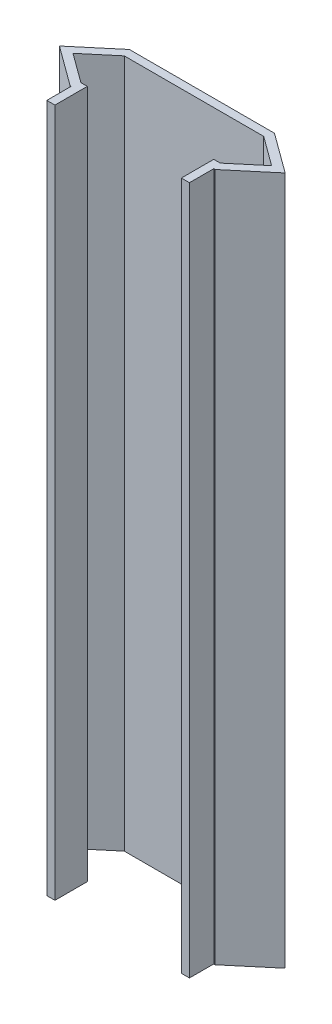
from build123d import *

# Parameters (mm, degrees)
BOSS_EXTRUDE2_DEPTH = 85


with BuildPart() as part:
    # Sketch1 → Boss-Extrude2 (new body)
    with BuildSketch(Plane(origin=(0, 0, 0), x_dir=(1, 0, 0), z_dir=(0, 1, 0))):
        Polygon((-9.289540275, -0.938702324), (-5.852697561, 1.95337278), (11.354665719, 1.95337278), (14.971998662, -0.690062833), (11.535155949, -3.582137937), (10.725726632, -3.582137937), (10.725726632, -6.582137937), (10.725726632, -7.582137937), (11.725726632, -7.582137937), (11.725726632, -4.582137937), (11.899920337, -4.582137937), (16.591006723, -0.634627016), (11.681112265, 2.95337278), (-6.21746195, 2.95337278), (-10.908548335, -0.994138141), (-5.998653878, -4.582137937), (-5.874273368, -4.582137937), (-5.874273368, -7.582137937), (-4.874273368, -7.582137937), (-4.874273368, -6.582137937), (-4.874273368, -3.582137937), (-5.672207332, -3.582137937), align=None)
    extrude(amount=BOSS_EXTRUDE2_DEPTH)


solid = part.part
